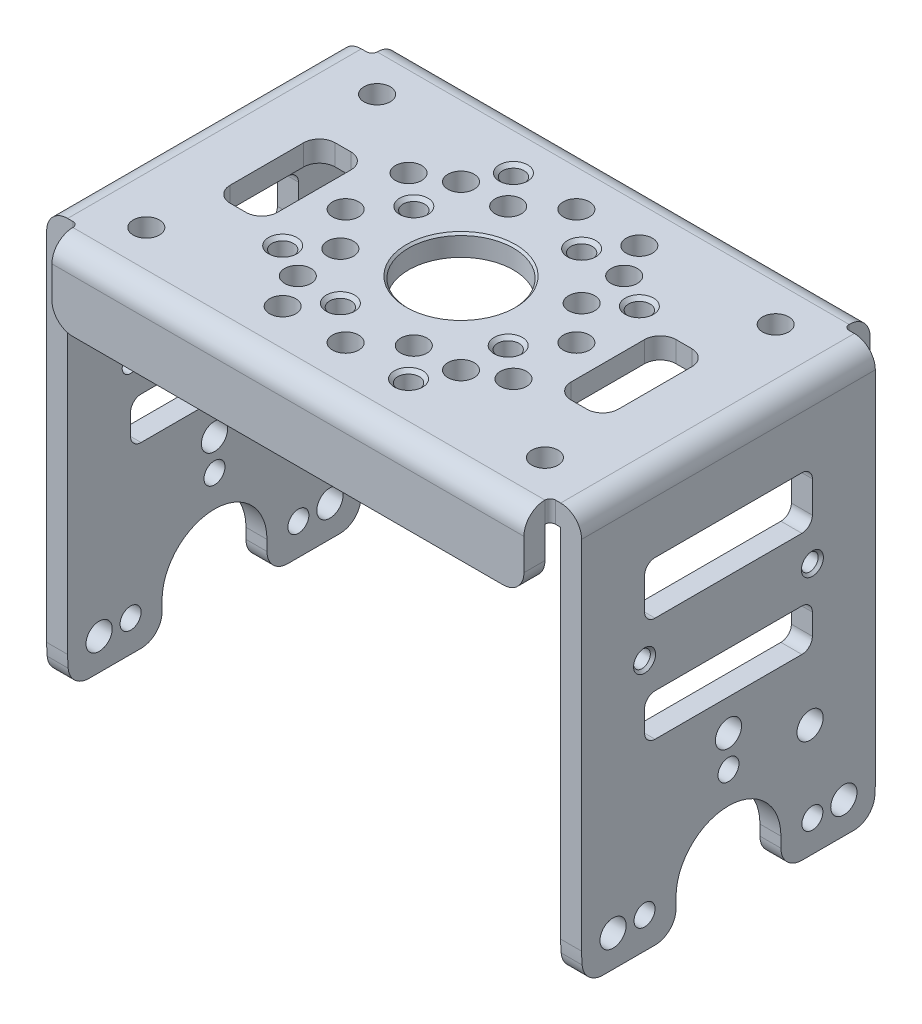
from build123d import *

# Parameters (mm, degrees)
CUT_EXTRUDE1_START     = -49
CUT_EXTRUDE1_OUTLINE_W = 2
CUT_EXTRUDE1_OUTLINE_H = 28
CUT_EXTRUDE1_DEPTH     = 51
CUT_EXTRUDE1_2_DEPTH   = 2
CUT_EXTRUDE1_3_DEPTH   = 2
SKETCH2_W              = 45
SKETCH2_H              = 2
BOSS_EXTRUDE1_DEPTH    = 2.5
SKETCH3_W              = 45
SKETCH3_H              = 2
BOSS_EXTRUDE2_DEPTH    = 5
SKETCH4_W              = 45
SKETCH4_H              = 2
BOSS_EXTRUDE3_DEPTH    = 2.5
SKETCH5_W              = 45
SKETCH5_H              = 2
BOSS_EXTRUDE4_DEPTH    = 5
CUT_EXTRUDE2_DEPTH     = 64.001984096
CUT_EXTRUDE3_DEPTH     = 64.001984096
SKETCH8_W              = 4.5
SKETCH8_H              = 10
CUT_EXTRUDE4_DEPTH     = 50.43177116
SKETCH9_W              = 16
SKETCH9_H              = 5
CUT_EXTRUDE5_DEPTH     = 64.001984096
SKETCH10_W             = 16
SKETCH10_H             = 4
CUT_EXTRUDE6_DEPTH     = 64.001984096
SKETCH11_W             = 16
SKETCH11_H             = 5
CUT_EXTRUDE7_DEPTH     = 64.001984096
SKETCH12_W             = 16
SKETCH12_H             = 4
CUT_EXTRUDE8_DEPTH     = 64.001984096
SKETCH13_W             = 4.5
SKETCH13_H             = 10
CUT_EXTRUDE9_DEPTH     = 48.86961458
HOLE1_D                = 2.5
HOLE2_D                = 2.5
HOLE3_D                = 2.5
HOLE4_D                = 2.5
HOLE5_D                = 2.5
CIRPATTERN1_COUNT      = 4
HOLE6_D                = 2.05
HOLE6_DEPTH            = 39
CIRPATTERN2_COUNT      = 4
HOLE7_D                = 2.5
CIRPATTERN3_COUNT      = 4
HOLE8_D                = 2.05
HOLE8_DEPTH            = 39
CIRPATTERN4_COUNT      = 4
HOLE9_D                = 2.5
CIRPATTERN5_COUNT      = 8
HOLE10_D               = 10
HOLE10_DEPTH           = 39
HOLE11_D               = 2
HOLE11_DEPTH           = 2
HOLE12_D               = 2
HOLE12_DEPTH           = 2
HOLE13_D               = 2
HOLE13_DEPTH           = 2
HOLE14_D               = 1.6
HOLE14_DEPTH           = 2
HOLE15_D               = 1.6
HOLE15_DEPTH           = 2
HOLE16_D               = 2.5
HOLE16_DEPTH           = 2
HOLE17_D               = 2.5
HOLE17_DEPTH           = 2
CIRPATTERN6_COUNT      = 8
HOLE18_D               = 2
HOLE19_D               = 2
HOLE20_D               = 2
HOLE21_D               = 1.6
HOLE21_DEPTH           = 51
HOLE22_D               = 1.6
HOLE22_DEPTH           = 51
HOLE23_D               = 2.5
HOLE23_DEPTH           = 51
HOLE24_D               = 2.5
HOLE24_DEPTH           = 51
CIRPATTERN7_COUNT      = 8
CHAMFER1_SIZE          = 0.25
CHAMFER2_SIZE          = 0.25
CHAMFER3_SIZE          = 0.325
CHAMFER4_SIZE          = 0.325
CHAMFER5_SIZE          = 0.325
CHAMFER6_SIZE          = 0.325
CHAMFER7_SIZE          = 0.325
CHAMFER8_SIZE          = 0.325
CHAMFER9_SIZE          = 0.2
CHAMFER10_SIZE         = 0.25
CHAMFER11_SIZE         = 0.325
CHAMFER12_SIZE         = 0.25
CHAMFER13_SIZE         = 0.325
FILLET1_R              = 0.5
FILLET2_R              = 0.5
FILLET3_R              = 0.5
FILLET4_R              = 0.5
FILLET5_R              = 1
FILLET6_R              = 1
FILLET7_R              = 1
FILLET8_R              = 1
FILLET9_R              = 1
FILLET10_R             = 1
FILLET11_R             = 1
FILLET12_R             = 1
FILLET13_R             = 1
FILLET14_R             = 1
FILLET15_R             = 1
FILLET16_R             = 1
FILLET17_R             = 1
FILLET18_R             = 1
FILLET19_R             = 1
FILLET20_R             = 1
FILLET21_R             = 1.5
FILLET22_R             = 1.5
FILLET23_R             = 1.5
FILLET24_R             = 1.5
FILLET25_R             = 1.5
FILLET26_R             = 1.5
FILLET27_R             = 1.5
FILLET28_R             = 1.5
FILLET29_R             = 2
FILLET30_R             = 2
FILLET31_R             = 2
FILLET32_R             = 2
FILLET33_R             = 2
FILLET34_R             = 2
FILLET35_R             = 2
FILLET36_R             = 2
FILLET37_R             = 2
FILLET38_R             = 2
FILLET39_R             = 2
FILLET40_R             = 2
FILLET41_R             = 2
FILLET42_R             = 2
FILLET43_R             = 2
FILLET44_R             = 2


with BuildPart() as part:
    # Cut-Extrude1: read off the stored shape, not the designer's step
    # Cut-Extrude1 outline → Cut-Extrude1 (new body)
    with BuildSketch(Plane(origin=(-23.5, 0, 0), x_dir=(0, -1, 0), z_dir=(-1, 0, 0)).offset(CUT_EXTRUDE1_START)):
        with Locations((-35, 0)):
            Rectangle(CUT_EXTRUDE1_OUTLINE_W, CUT_EXTRUDE1_OUTLINE_H)
    extrude(amount=CUT_EXTRUDE1_DEPTH)

    # Cut-Extrude1 2 outline → Cut-Extrude1 2 (add)
    with BuildSketch(Plane(origin=(-23.5, 0, 0), x_dir=(0, -1, 0), z_dir=(-1, 0, 0)).offset(CUT_EXTRUDE1_START)):
        with BuildLine():
            ThreePointArc((0, -14), (1.508787487, -13.918461133), (3, -13.674794331))
            Line((3, -13.674794331), (3, 13.674794331))
            ThreePointArc((3, 13.674794331), (1.508787487, 13.918461133), (0, 14))
            Line((0, 14), (-34, 14))
            Line((-34, 14), (-34, -14))
            Line((-34, -14), (0, -14))
        make_face()
    extrude(amount=CUT_EXTRUDE1_2_DEPTH)

    # Cut-Extrude1 3 outline → Cut-Extrude1 3 (add)
    with BuildSketch(Plane(origin=(-23.5, 0, 0), x_dir=(0, -1, 0), z_dir=(-1, 0, 0))):
        with BuildLine():
            ThreePointArc((0, -14), (1.508787487, -13.918461133), (3, -13.674794331))
            Line((3, -13.674794331), (3, 13.674794331))
            ThreePointArc((3, 13.674794331), (1.508787487, 13.918461133), (0, 14))
            Line((0, 14), (-34, 14))
            Line((-34, 14), (-34, -14))
            Line((-34, -14), (0, -14))
        make_face()
    extrude(amount=CUT_EXTRUDE1_3_DEPTH)

    # Sketch2 → Boss-Extrude1 (add)
    with BuildSketch(Plane(origin=(0, 0, -14), x_dir=(-1, 0, 0), z_dir=(0, 0, -1))):
        with Locations((0, 35)):
            Rectangle(SKETCH2_W, SKETCH2_H)
    extrude(amount=BOSS_EXTRUDE1_DEPTH)

    # Sketch3 → Boss-Extrude2 (add)
    with BuildSketch(Plane.XZ.offset(-34)):
        with Locations((0, -15.5)):
            Rectangle(SKETCH3_W, SKETCH3_H)
    extrude(amount=BOSS_EXTRUDE2_DEPTH)

    # Sketch4 → Boss-Extrude3 (add)
    with BuildSketch(Plane.XY.offset(14)):
        with Locations((0, 35)):
            Rectangle(SKETCH4_W, SKETCH4_H)
    extrude(amount=BOSS_EXTRUDE3_DEPTH)

    # Sketch5 → Boss-Extrude4 (add)
    with BuildSketch(Plane.XZ.offset(-34)):
        with Locations((0, 15.5)):
            Rectangle(SKETCH5_W, SKETCH5_H)
    extrude(amount=BOSS_EXTRUDE4_DEPTH)

    # Sketch6 → Cut-Extrude2 (cut, through all)
    with BuildSketch(Plane(origin=(-23.5, 0, 0), x_dir=(0, 0, -1), z_dir=(1, 0, 0))):
        with BuildLine():
            Line((5, -3), (5, 0))
            ThreePointArc((5, 0), (0, 5), (-5, 0))
            Line((-5, 0), (-5, -3))
            Line((-5, -3), (5, -3))
        make_face()
    extrude(amount=-CUT_EXTRUDE2_DEPTH, mode=Mode.SUBTRACT)

    # Sketch7 → Cut-Extrude3 (cut, through all)
    with BuildSketch(Plane.ZY.offset(-23.5)):
        with BuildLine():
            Line((5, -3), (5, 0))
            ThreePointArc((5, 0), (0, 5), (-5, 0))
            Line((-5, 0), (-5, -3))
            Line((-5, -3), (5, -3))
        make_face()
    extrude(amount=-CUT_EXTRUDE3_DEPTH, mode=Mode.SUBTRACT)

    # Sketch8 → Cut-Extrude4 (cut, through all)
    with BuildSketch(Plane(origin=(0, 36, 0), x_dir=(-1, 0, 0), z_dir=(0, 1, 0))):
        with Locations((16.25, 0)):
            Rectangle(SKETCH8_W, SKETCH8_H)
    extrude(amount=-CUT_EXTRUDE4_DEPTH, mode=Mode.SUBTRACT)

    # Sketch9 → Cut-Extrude5 (cut, through all)
    with BuildSketch(Plane(origin=(-23.5, 0, 0), x_dir=(0, 0, -1), z_dir=(1, 0, 0))):
        with Locations((0, 26.5)):
            Rectangle(SKETCH9_W, SKETCH9_H)
    extrude(amount=-CUT_EXTRUDE5_DEPTH, mode=Mode.SUBTRACT)

    # Sketch10 → Cut-Extrude6 (cut, through all)
    with BuildSketch(Plane(origin=(-23.5, 0, 0), x_dir=(0, 0, -1), z_dir=(1, 0, 0))):
        with Locations((0, 16)):
            Rectangle(SKETCH10_W, SKETCH10_H)
    extrude(amount=-CUT_EXTRUDE6_DEPTH, mode=Mode.SUBTRACT)

    # Sketch11 → Cut-Extrude7 (cut, through all)
    with BuildSketch(Plane.ZY.offset(-23.5)):
        with Locations((0, 26.5)):
            Rectangle(SKETCH11_W, SKETCH11_H)
    extrude(amount=-CUT_EXTRUDE7_DEPTH, mode=Mode.SUBTRACT)

    # Sketch12 → Cut-Extrude8 (cut, through all)
    with BuildSketch(Plane.ZY.offset(-23.5)):
        with Locations((0, 16)):
            Rectangle(SKETCH12_W, SKETCH12_H)
    extrude(amount=-CUT_EXTRUDE8_DEPTH, mode=Mode.SUBTRACT)

    # Sketch13 → Cut-Extrude9 (cut, through all)
    with BuildSketch(Plane.XZ.offset(-34)):
        with Locations((16.25, 0)):
            Rectangle(SKETCH13_W, SKETCH13_H)
    extrude(amount=-CUT_EXTRUDE9_DEPTH, mode=Mode.SUBTRACT)

    # Hole1 (through all)
    with Locations(Plane.XZ.offset(-34)):
        with Locations((-19, 11)):
            Hole(HOLE1_D / 2)

    # Hole2 (through all)
    with Locations(Plane.XZ.offset(-34)):
        with Locations((19, 11)):
            Hole(HOLE2_D / 2)

    # Hole3 (through all)
    with Locations(Plane.XZ.offset(-34)):
        with Locations((-19, -11)):
            Hole(HOLE3_D / 2)

    # Hole4 (through all)
    with Locations(Plane.XZ.offset(-34)):
        with Locations((19, -11)):
            Hole(HOLE4_D / 2)

    # Hole5 (through all)
    with Locations(Plane.XZ.offset(-34)):
        with Locations((-11, -6)):
            hole5 = Hole(HOLE5_D / 2)

    # CirPattern1: Hole5 ×4 about axis
    cirpattern1_axis = Axis((0, 0, 0), (0, 1, 0))
    for i in range(1, CIRPATTERN1_COUNT):
        add(hole5.rotate(cirpattern1_axis, i * 360 / CIRPATTERN1_COUNT), mode=Mode.SUBTRACT)

    # Hole6
    with Locations(Plane(origin=(0, 36, 0), x_dir=(-1, 0, 0), z_dir=(0, 1, 0))):
        with Locations((6, -11)):
            hole6 = Hole(HOLE6_D / 2, depth=HOLE6_DEPTH)

    # CirPattern2: Hole6 ×4 about axis
    cirpattern2_axis = Axis((0, 0, 0), (0, 1, 0))
    for i in range(1, CIRPATTERN2_COUNT):
        add(hole6.rotate(cirpattern2_axis, i * 360 / CIRPATTERN2_COUNT), mode=Mode.SUBTRACT)

    # Hole7 (through all)
    with Locations(Plane.XZ.offset(-34)):
        with Locations((3.5, 8)):
            hole7 = Hole(HOLE7_D / 2)

    # CirPattern3: Hole7 ×4 about axis
    cirpattern3_axis = Axis((0, 0, 0), (0, 1, 0))
    for i in range(1, CIRPATTERN3_COUNT):
        add(hole7.rotate(cirpattern3_axis, i * 360 / CIRPATTERN3_COUNT), mode=Mode.SUBTRACT)

    # Hole8
    with Locations(Plane(origin=(0, 36, 0), x_dir=(-1, 0, 0), z_dir=(0, 1, 0))):
        with Locations((8, -3.5)):
            hole8 = Hole(HOLE8_D / 2, depth=HOLE8_DEPTH)

    # CirPattern4: Hole8 ×4 about axis
    cirpattern4_axis = Axis((0, 0, 0), (0, 1, 0))
    for i in range(1, CIRPATTERN4_COUNT):
        add(hole8.rotate(cirpattern4_axis, i * 360 / CIRPATTERN4_COUNT), mode=Mode.SUBTRACT)

    # Hole9 (through all)
    with Locations(Plane.XZ.offset(-34)):
        with Locations((0, 11)):
            hole9 = Hole(HOLE9_D / 2)

    # CirPattern5: Hole9 ×8 about axis
    cirpattern5_axis = Axis((0, 0, 0), (0, 1, 0))
    for i in range(1, CIRPATTERN5_COUNT):
        add(hole9.rotate(cirpattern5_axis, i * 360 / CIRPATTERN5_COUNT), mode=Mode.SUBTRACT)

    # Hole10
    with Locations(Plane(origin=(0, 36, 0), x_dir=(-1, 0, 0), z_dir=(0, 1, 0))):
        with Locations((0, 0)):
            Hole(HOLE10_D / 2, depth=HOLE10_DEPTH)

    # Hole11
    with Locations(Plane.ZY.offset(-23.5)):
        with Locations((8, 0)):
            Hole(HOLE11_D / 2, depth=HOLE11_DEPTH)

    # Hole12
    with Locations(Plane.ZY.offset(-23.5)):
        with Locations((0, 8)):
            Hole(HOLE12_D / 2, depth=HOLE12_DEPTH)

    # Hole13
    with Locations(Plane.ZY.offset(-23.5)):
        with Locations((-8, 0)):
            Hole(HOLE13_D / 2, depth=HOLE13_DEPTH)

    # Hole14
    with Locations(Plane(origin=(25.5, 0, 0), x_dir=(0, 0, -1), z_dir=(1, 0, 0))):
        with Locations((-8, 21)):
            Hole(HOLE14_D / 2, depth=HOLE14_DEPTH)

    # Hole15
    with Locations(Plane(origin=(25.5, 0, 0), x_dir=(0, 0, -1), z_dir=(1, 0, 0))):
        with Locations((8, 21)):
            Hole(HOLE15_D / 2, depth=HOLE15_DEPTH)

    # Hole16
    with Locations(Plane.ZY.offset(-23.5)):
        with Locations((0, 11)):
            Hole(HOLE16_D / 2, depth=HOLE16_DEPTH)

    # Hole17
    with Locations(Plane.ZY.offset(-23.5)):
        with Locations((11, 0)):
            hole17 = Hole(HOLE17_D / 2, depth=HOLE17_DEPTH)

    # CirPattern6: Hole17 ×8 about axis, 5 skipped
    cirpattern6_axis = Axis((124.5, 0, 0), (-1, 0, 0))
    add([hole17.rotate(cirpattern6_axis, i * 360 / CIRPATTERN6_COUNT) for i in range(1, CIRPATTERN6_COUNT) if i not in (1, 2, 5, 6, 7)], mode=Mode.SUBTRACT)

    # Hole18 (through all)
    with Locations(Plane(origin=(-23.5, 0, 0), x_dir=(0, 0, -1), z_dir=(1, 0, 0))):
        with Locations((-8, 0)):
            Hole(HOLE18_D / 2)

    # Hole19 (through all)
    with Locations(Plane(origin=(-23.5, 0, 0), x_dir=(0, 0, -1), z_dir=(1, 0, 0))):
        with Locations((0, 8)):
            Hole(HOLE19_D / 2)

    # Hole20 (through all)
    with Locations(Plane(origin=(-23.5, 0, 0), x_dir=(0, 0, -1), z_dir=(1, 0, 0))):
        with Locations((8, 0)):
            Hole(HOLE20_D / 2)

    # Hole21
    with Locations(Plane.ZY.offset(25.5)):
        with Locations((8, 21)):
            Hole(HOLE21_D / 2, depth=HOLE21_DEPTH)

    # Hole22
    with Locations(Plane.ZY.offset(25.5)):
        with Locations((-8, 21)):
            Hole(HOLE22_D / 2, depth=HOLE22_DEPTH)

    # Hole23
    with Locations(Plane.ZY.offset(25.5)):
        with Locations((0, 11)):
            Hole(HOLE23_D / 2, depth=HOLE23_DEPTH)

    # Hole24
    with Locations(Plane.ZY.offset(25.5)):
        with Locations((11, 0)):
            hole24 = Hole(HOLE24_D / 2, depth=HOLE24_DEPTH)

    # CirPattern7: Hole24 ×8 about axis, 5 skipped
    cirpattern7_axis = Axis((75.5, 0, 0), (-1, 0, 0))
    add([hole24.rotate(cirpattern7_axis, i * 360 / CIRPATTERN7_COUNT) for i in range(1, CIRPATTERN7_COUNT) if i not in (1, 2, 5, 6, 7)], mode=Mode.SUBTRACT)

    # Chamfer1
    chamfer1_edges = [part.edges().sort_by_distance(p)[0] for p in [
        (25.5, 21, -8.8),
    ]]
    chamfer(chamfer1_edges, length=CHAMFER1_SIZE)

    # Chamfer2
    chamfer2_edges = [part.edges().sort_by_distance(p)[0] for p in [
        (-25.5, 21, 8.8),
    ]]
    chamfer(chamfer2_edges, length=CHAMFER2_SIZE)

    # Chamfer3
    chamfer3_edges = [part.edges().sort_by_distance(p)[0] for p in [
        (-7.025, 36, -11),
    ]]
    chamfer(chamfer3_edges, length=CHAMFER3_SIZE)

    # Chamfer4
    chamfer4_edges = [part.edges().sort_by_distance(p)[0] for p in [
        (-11, 36, 7.025),
    ]]
    chamfer(chamfer4_edges, length=CHAMFER4_SIZE)

    # Chamfer5
    chamfer5_edges = [part.edges().sort_by_distance(p)[0] for p in [
        (7.025, 36, 11),
    ]]
    chamfer(chamfer5_edges, length=CHAMFER5_SIZE)

    # Chamfer6
    chamfer6_edges = [part.edges().sort_by_distance(p)[0] for p in [
        (11, 36, -7.025),
    ]]
    chamfer(chamfer6_edges, length=CHAMFER6_SIZE)

    # Chamfer7
    chamfer7_edges = [part.edges().sort_by_distance(p)[0] for p in [
        (-9.025, 36, -3.5),
    ]]
    chamfer(chamfer7_edges, length=CHAMFER7_SIZE)

    # Chamfer8
    chamfer8_edges = [part.edges().sort_by_distance(p)[0] for p in [
        (9.025, 36, 3.5),
    ]]
    chamfer(chamfer8_edges, length=CHAMFER8_SIZE)

    # Chamfer9
    chamfer9_edges = [part.edges().sort_by_distance(p)[0] for p in [
        (-5, 36, 0),
    ]]
    chamfer(chamfer9_edges, length=CHAMFER9_SIZE)

    # Chamfer10
    chamfer10_edges = [part.edges().sort_by_distance(p)[0] for p in [
        (-25.5, 21, -7.2),
    ]]
    chamfer(chamfer10_edges, length=CHAMFER10_SIZE)

    # Chamfer11
    chamfer11_edges = [part.edges().sort_by_distance(p)[0] for p in [
        (-3.5, 36, 9.025),
    ]]
    chamfer(chamfer11_edges, length=CHAMFER11_SIZE)

    # Chamfer12
    chamfer12_edges = [part.edges().sort_by_distance(p)[0] for p in [
        (25.5, 21, 7.2),
    ]]
    chamfer(chamfer12_edges, length=CHAMFER12_SIZE)

    # Chamfer13
    chamfer13_edges = [part.edges().sort_by_distance(p)[0] for p in [
        (3.5, 36, -9.025),
    ]]
    chamfer(chamfer13_edges, length=CHAMFER13_SIZE)

    # Fillet1
    fillet1_edges = [part.edges().sort_by_distance(p)[0] for p in [
        (-22.5, 35, 14),
    ]]
    fillet(fillet1_edges, radius=FILLET1_R)

    # Fillet2
    fillet2_edges = [part.edges().sort_by_distance(p)[0] for p in [
        (-22.5, 35, -14),
    ]]
    fillet(fillet2_edges, radius=FILLET2_R)

    # Fillet3
    fillet3_edges = [part.edges().sort_by_distance(p)[0] for p in [
        (22.5, 35, -14),
    ]]
    fillet(fillet3_edges, radius=FILLET3_R)

    # Fillet4
    fillet4_edges = [part.edges().sort_by_distance(p)[0] for p in [
        (22.5, 35, 14),
    ]]
    fillet(fillet4_edges, radius=FILLET4_R)

    # Fillet5
    fillet5_edges = [part.edges().sort_by_distance(p)[0] for p in [
        (24.5, 14, 8),
    ]]
    fillet(fillet5_edges, radius=FILLET5_R)

    # Fillet6
    fillet6_edges = [part.edges().sort_by_distance(p)[0] for p in [
        (24.5, 14, -8),
    ]]
    fillet(fillet6_edges, radius=FILLET6_R)

    # Fillet7
    fillet7_edges = [part.edges().sort_by_distance(p)[0] for p in [
        (24.5, 18, -8),
    ]]
    fillet(fillet7_edges, radius=FILLET7_R)

    # Fillet8
    fillet8_edges = [part.edges().sort_by_distance(p)[0] for p in [
        (24.5, 24, -8),
    ]]
    fillet(fillet8_edges, radius=FILLET8_R)

    # Fillet9
    fillet9_edges = [part.edges().sort_by_distance(p)[0] for p in [
        (24.5, 29, 8),
    ]]
    fillet(fillet9_edges, radius=FILLET9_R)

    # Fillet10
    fillet10_edges = [part.edges().sort_by_distance(p)[0] for p in [
        (-24.5, 18, -8),
    ]]
    fillet(fillet10_edges, radius=FILLET10_R)

    # Fillet11
    fillet11_edges = [part.edges().sort_by_distance(p)[0] for p in [
        (24.5, 29, -8),
    ]]
    fillet(fillet11_edges, radius=FILLET11_R)

    # Fillet12
    fillet12_edges = [part.edges().sort_by_distance(p)[0] for p in [
        (-24.5, 24, 8),
    ]]
    fillet(fillet12_edges, radius=FILLET12_R)

    # Fillet13
    fillet13_edges = [part.edges().sort_by_distance(p)[0] for p in [
        (-24.5, 18, 8),
    ]]
    fillet(fillet13_edges, radius=FILLET13_R)

    # Fillet14
    fillet14_edges = [part.edges().sort_by_distance(p)[0] for p in [
        (-24.5, 29, 8),
    ]]
    fillet(fillet14_edges, radius=FILLET14_R)

    # Fillet15
    fillet15_edges = [part.edges().sort_by_distance(p)[0] for p in [
        (-24.5, 14, 8),
    ]]
    fillet(fillet15_edges, radius=FILLET15_R)

    # Fillet16
    fillet16_edges = [part.edges().sort_by_distance(p)[0] for p in [
        (-24.5, 14, -8),
    ]]
    fillet(fillet16_edges, radius=FILLET16_R)

    # Fillet17
    fillet17_edges = [part.edges().sort_by_distance(p)[0] for p in [
        (24.5, 18, 8),
    ]]
    fillet(fillet17_edges, radius=FILLET17_R)

    # Fillet18
    fillet18_edges = [part.edges().sort_by_distance(p)[0] for p in [
        (-24.5, 29, -8),
    ]]
    fillet(fillet18_edges, radius=FILLET18_R)

    # Fillet19
    fillet19_edges = [part.edges().sort_by_distance(p)[0] for p in [
        (-24.5, 24, -8),
    ]]
    fillet(fillet19_edges, radius=FILLET19_R)

    # Fillet20
    fillet20_edges = [part.edges().sort_by_distance(p)[0] for p in [
        (24.5, 24, 8),
    ]]
    fillet(fillet20_edges, radius=FILLET20_R)

    # Fillet21
    fillet21_edges = [part.edges().sort_by_distance(p)[0] for p in [
        (-14, 35, 5),
    ]]
    fillet(fillet21_edges, radius=FILLET21_R)

    # Fillet22
    fillet22_edges = [part.edges().sort_by_distance(p)[0] for p in [
        (14, 35, 5),
    ]]
    fillet(fillet22_edges, radius=FILLET22_R)

    # Fillet23
    fillet23_edges = [part.edges().sort_by_distance(p)[0] for p in [
        (-18.5, 35, 5),
    ]]
    fillet(fillet23_edges, radius=FILLET23_R)

    # Fillet24
    fillet24_edges = [part.edges().sort_by_distance(p)[0] for p in [
        (14, 35, -5),
    ]]
    fillet(fillet24_edges, radius=FILLET24_R)

    # Fillet25
    fillet25_edges = [part.edges().sort_by_distance(p)[0] for p in [
        (-14, 35, -5),
    ]]
    fillet(fillet25_edges, radius=FILLET25_R)

    # Fillet26
    fillet26_edges = [part.edges().sort_by_distance(p)[0] for p in [
        (18.5, 35, 5),
    ]]
    fillet(fillet26_edges, radius=FILLET26_R)

    # Fillet27
    fillet27_edges = [part.edges().sort_by_distance(p)[0] for p in [
        (18.5, 35, -5),
    ]]
    fillet(fillet27_edges, radius=FILLET27_R)

    # Fillet28
    fillet28_edges = [part.edges().sort_by_distance(p)[0] for p in [
        (-18.5, 35, -5),
    ]]
    fillet(fillet28_edges, radius=FILLET28_R)

    # Fillet29
    fillet29_edges = [part.edges().sort_by_distance(p)[0] for p in [
        (-25.5, 36, 0),
    ]]
    fillet(fillet29_edges, radius=FILLET29_R)

    # Fillet30
    fillet30_edges = [part.edges().sort_by_distance(p)[0] for p in [
        (-24.5, -3, 5),
    ]]
    fillet(fillet30_edges, radius=FILLET30_R)

    # Fillet31
    fillet31_edges = [part.edges().sort_by_distance(p)[0] for p in [
        (-24.5, -3, 13.674794331),
    ]]
    fillet(fillet31_edges, radius=FILLET31_R)

    # Fillet32
    fillet32_edges = [part.edges().sort_by_distance(p)[0] for p in [
        (22.5, 29, 15.5),
    ]]
    fillet(fillet32_edges, radius=FILLET32_R)

    # Fillet33
    fillet33_edges = [part.edges().sort_by_distance(p)[0] for p in [
        (25.5, 36, 0),
    ]]
    fillet(fillet33_edges, radius=FILLET33_R)

    # Fillet34
    fillet34_edges = [part.edges().sort_by_distance(p)[0] for p in [
        (24.5, -3, 5),
    ]]
    fillet(fillet34_edges, radius=FILLET34_R)

    # Fillet35
    fillet35_edges = [part.edges().sort_by_distance(p)[0] for p in [
        (0, 36, -16.5),
    ]]
    fillet(fillet35_edges, radius=FILLET35_R)

    # Fillet36
    fillet36_edges = [part.edges().sort_by_distance(p)[0] for p in [
        (24.5, -3, -13.674794331),
    ]]
    fillet(fillet36_edges, radius=FILLET36_R)

    # Fillet37
    fillet37_edges = [part.edges().sort_by_distance(p)[0] for p in [
        (0, 36, 16.5),
    ]]
    fillet(fillet37_edges, radius=FILLET37_R)

    # Fillet38
    fillet38_edges = [part.edges().sort_by_distance(p)[0] for p in [
        (-22.5, 29, -15.5),
    ]]
    fillet(fillet38_edges, radius=FILLET38_R)

    # Fillet39
    fillet39_edges = [part.edges().sort_by_distance(p)[0] for p in [
        (22.5, 29, -15.5),
    ]]
    fillet(fillet39_edges, radius=FILLET39_R)

    # Fillet40
    fillet40_edges = [part.edges().sort_by_distance(p)[0] for p in [
        (-24.5, -3, -5),
    ]]
    fillet(fillet40_edges, radius=FILLET40_R)

    # Fillet41
    fillet41_edges = [part.edges().sort_by_distance(p)[0] for p in [
        (-24.5, -3, -13.674794331),
    ]]
    fillet(fillet41_edges, radius=FILLET41_R)

    # Fillet42
    fillet42_edges = [part.edges().sort_by_distance(p)[0] for p in [
        (24.5, -3, 13.674794331),
    ]]
    fillet(fillet42_edges, radius=FILLET42_R)

    # Fillet43
    fillet43_edges = [part.edges().sort_by_distance(p)[0] for p in [
        (-22.5, 29, 15.5),
    ]]
    fillet(fillet43_edges, radius=FILLET43_R)

    # Fillet44
    fillet44_edges = [part.edges().sort_by_distance(p)[0] for p in [
        (24.5, -3, -5),
    ]]
    fillet(fillet44_edges, radius=FILLET44_R)


solid = part.part
